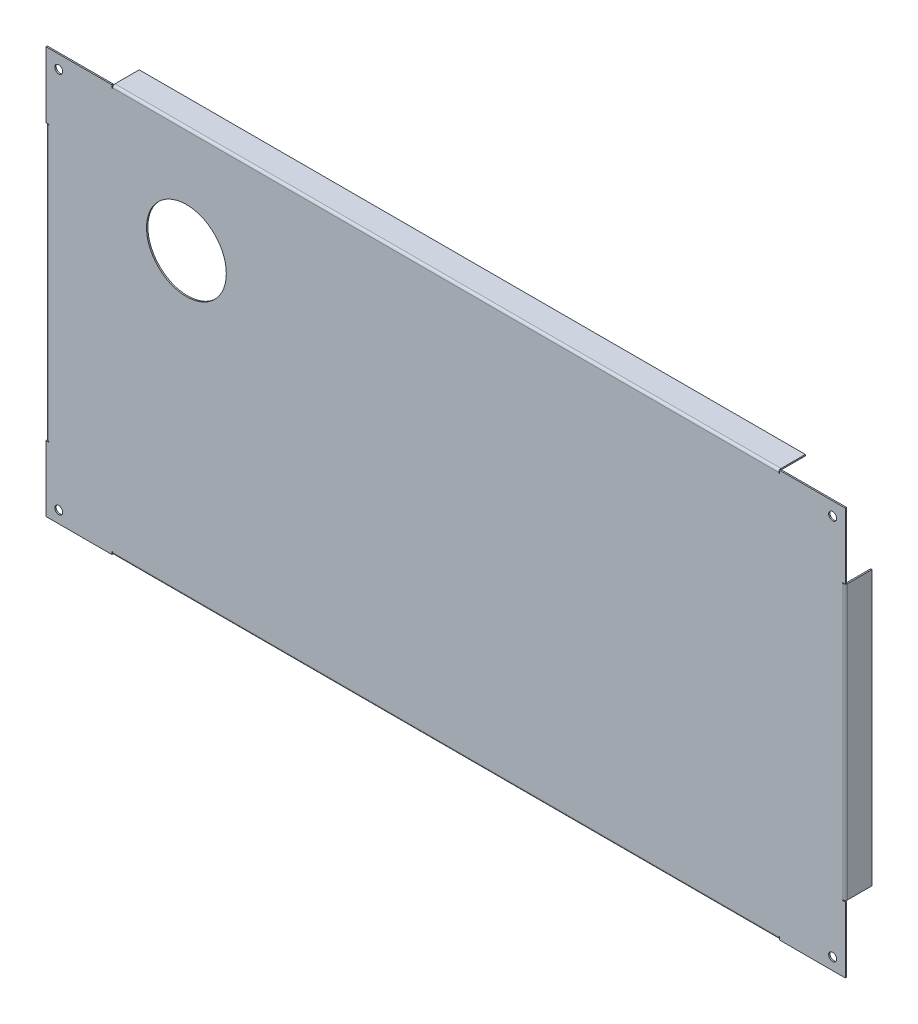
from build123d import *

# Parameters (mm, degrees)
SKETCH_1_W                        = 601
SKETCH_1_H                        = 306
SKETCH_1_R                        = 30
SM_BASE_FLANGE_1_DEPTH            = 1
SM_EDGE_FLANGE_1_STRIP_W          = 5.4732
SM_EDGE_FLANGE_1_STRIP_H          = 1
SM_EDGE_FLANGE_1_STRIP_CUT_DEPTH  = 501
SM_EDGE_FLANGE_1_RELIEF_W         = 5.9732
SM_EDGE_FLANGE_1_RELIEF_H         = 0.5
SM_EDGE_FLANGE_1_RELIEF_CUT_DEPTH = 1
SM_EDGE_FLANGE_1_DEPTH            = 501
SM_EDGE_FLANGE_2_STRIP_W          = 5.4732
SM_EDGE_FLANGE_2_STRIP_H          = 1
SM_EDGE_FLANGE_2_STRIP_CUT_DEPTH  = 206
SM_EDGE_FLANGE_2_RELIEF_W         = 5.9732
SM_EDGE_FLANGE_2_RELIEF_H         = 0.5
SM_EDGE_FLANGE_2_RELIEF_CUT_DEPTH = 1
SM_EDGE_FLANGE_2_DEPTH            = 206
SM_EDGE_FLANGE_3_STRIP_W          = 5.4732
SM_EDGE_FLANGE_3_STRIP_H          = 1
SM_EDGE_FLANGE_3_STRIP_CUT_DEPTH  = 501
SM_EDGE_FLANGE_3_RELIEF_W         = 5.9732
SM_EDGE_FLANGE_3_RELIEF_H         = 0.5
SM_EDGE_FLANGE_3_RELIEF_CUT_DEPTH = 1
SM_EDGE_FLANGE_3_DEPTH            = 501
SM_EDGE_FLANGE_4_STRIP_W          = 5.4732
SM_EDGE_FLANGE_4_STRIP_H          = 1
SM_EDGE_FLANGE_4_STRIP_CUT_DEPTH  = 206
SM_EDGE_FLANGE_4_RELIEF_W         = 5.9732
SM_EDGE_FLANGE_4_RELIEF_H         = 0.5
SM_EDGE_FLANGE_4_RELIEF_CUT_DEPTH = 1
SM_EDGE_FLANGE_4_DEPTH            = 206
SKETCH_15_R                       = 3
CUT_EXTRUDE_1_DEPTH               = 338.800606867


# Sheet-metal steps are written as plain solids
with BuildPart() as part:
    # Sketch 1 → 基体-法兰1 (new body)
    with BuildSketch(Plane.XY):
        Rectangle(SKETCH_1_W, SKETCH_1_H)
        with Locations((-195, 73)):
            Circle(SKETCH_1_R, mode=Mode.SUBTRACT)
    extrude(amount=-SM_BASE_FLANGE_1_DEPTH)

    # 边线-法兰1 strip (across the edge) → 边线-法兰1 strip cut (cut)
    with BuildSketch(Plane(origin=(-250.5, 153, -1), x_dir=(0, -1, 0), z_dir=(1, 0, 0))):
        with Locations((-1, -0.5)):
            Rectangle(SM_EDGE_FLANGE_1_STRIP_W, SM_EDGE_FLANGE_1_STRIP_H)
    extrude(amount=SM_EDGE_FLANGE_1_STRIP_CUT_DEPTH, mode=Mode.SUBTRACT)

    # 边线-法兰1 relief (on the sheet) → 边线-法兰1 relief cut (cut)
    with BuildSketch(Plane(origin=(-250.5, 151.2634, -1), x_dir=(0, -1, 0), z_dir=(0, 0, -1))):
        with Locations((-2.4866, 0.25)):
            Rectangle(SM_EDGE_FLANGE_1_RELIEF_W, SM_EDGE_FLANGE_1_RELIEF_H)
        with Locations((-2.4866, -501.25)):
            Rectangle(SM_EDGE_FLANGE_1_RELIEF_W, SM_EDGE_FLANGE_1_RELIEF_H)
    extrude(amount=-SM_EDGE_FLANGE_1_RELIEF_CUT_DEPTH, mode=Mode.SUBTRACT)

    # 边线-法兰1 section (across the edge) → 边线-法兰1 (add)
    with BuildSketch(Plane(origin=(-250.5, 153, -1), x_dir=(0, -1, 0), z_dir=(1, 0, 0))):
        with BuildLine():
            Line((0, 0.7366), (0, 19))
            Line((0, 19), (1, 19))
            Line((1, 19), (1, 0.7366))
            ThreePointArc((1, 0.7366), (1.215745145, 0.215745145), (1.7366, 0))
            Line((1.7366, 0), (1.7366, -1))
            ThreePointArc((1.7366, -1), (0.508638364, -0.491361636), (0, 0.7366))
        make_face()
    extrude(amount=SM_EDGE_FLANGE_1_DEPTH)

    # 边线-法兰2 strip (across the edge) → 边线-法兰2 strip cut (cut)
    with BuildSketch(Plane(origin=(300.5, 103, -1), x_dir=(-1, 0, 0), z_dir=(0, -1, 0))):
        with Locations((-1, -0.5)):
            Rectangle(SM_EDGE_FLANGE_2_STRIP_W, SM_EDGE_FLANGE_2_STRIP_H)
    extrude(amount=SM_EDGE_FLANGE_2_STRIP_CUT_DEPTH, mode=Mode.SUBTRACT)

    # 边线-法兰2 relief (on the sheet) → 边线-法兰2 relief cut (cut)
    with BuildSketch(Plane(origin=(298.7634, 103, -1), x_dir=(-1, 0, 0), z_dir=(0, 0, -1))):
        with Locations((-2.4866, 0.25)):
            Rectangle(SM_EDGE_FLANGE_2_RELIEF_W, SM_EDGE_FLANGE_2_RELIEF_H)
        with Locations((-2.4866, -206.25)):
            Rectangle(SM_EDGE_FLANGE_2_RELIEF_W, SM_EDGE_FLANGE_2_RELIEF_H)
    extrude(amount=-SM_EDGE_FLANGE_2_RELIEF_CUT_DEPTH, mode=Mode.SUBTRACT)

    # 边线-法兰2 section (across the edge) → 边线-法兰2 (add)
    with BuildSketch(Plane(origin=(300.5, 103, -1), x_dir=(-1, 0, 0), z_dir=(0, -1, 0))):
        with BuildLine():
            Line((0, 0.7366), (0, 19))
            Line((0, 19), (1, 19))
            Line((1, 19), (1, 0.7366))
            ThreePointArc((1, 0.7366), (1.215745145, 0.215745145), (1.7366, 0))
            Line((1.7366, 0), (1.7366, -1))
            ThreePointArc((1.7366, -1), (0.508638364, -0.491361636), (0, 0.7366))
        make_face()
    extrude(amount=SM_EDGE_FLANGE_2_DEPTH)

    # 边线-法兰3 strip (across the edge) → 边线-法兰3 strip cut (cut)
    with BuildSketch(Plane(origin=(250.5, -153, -1), x_dir=(0, 1, 0), z_dir=(-1, 0, 0))):
        with Locations((-1, -0.5)):
            Rectangle(SM_EDGE_FLANGE_3_STRIP_W, SM_EDGE_FLANGE_3_STRIP_H)
    extrude(amount=SM_EDGE_FLANGE_3_STRIP_CUT_DEPTH, mode=Mode.SUBTRACT)

    # 边线-法兰3 relief (on the sheet) → 边线-法兰3 relief cut (cut)
    with BuildSketch(Plane(origin=(250.5, -151.2634, -1), x_dir=(0, 1, 0), z_dir=(0, 0, -1))):
        with Locations((-2.4866, 0.25)):
            Rectangle(SM_EDGE_FLANGE_3_RELIEF_W, SM_EDGE_FLANGE_3_RELIEF_H)
        with Locations((-2.4866, -501.25)):
            Rectangle(SM_EDGE_FLANGE_3_RELIEF_W, SM_EDGE_FLANGE_3_RELIEF_H)
    extrude(amount=-SM_EDGE_FLANGE_3_RELIEF_CUT_DEPTH, mode=Mode.SUBTRACT)

    # 边线-法兰3 section (across the edge) → 边线-法兰3 (add)
    with BuildSketch(Plane(origin=(250.5, -153, -1), x_dir=(0, 1, 0), z_dir=(-1, 0, 0))):
        with BuildLine():
            Line((0, 0.7366), (0, 19))
            Line((0, 19), (1, 19))
            Line((1, 19), (1, 0.7366))
            ThreePointArc((1, 0.7366), (1.215745145, 0.215745145), (1.7366, 0))
            Line((1.7366, 0), (1.7366, -1))
            ThreePointArc((1.7366, -1), (0.508638364, -0.491361636), (0, 0.7366))
        make_face()
    extrude(amount=SM_EDGE_FLANGE_3_DEPTH)

    # 边线-法兰4 strip (across the edge) → 边线-法兰4 strip cut (cut)
    with BuildSketch(Plane(origin=(-300.5, -103, -1), x_dir=(1, 0, 0), z_dir=(0, 1, 0))):
        with Locations((-1, -0.5)):
            Rectangle(SM_EDGE_FLANGE_4_STRIP_W, SM_EDGE_FLANGE_4_STRIP_H)
    extrude(amount=SM_EDGE_FLANGE_4_STRIP_CUT_DEPTH, mode=Mode.SUBTRACT)

    # 边线-法兰4 relief (on the sheet) → 边线-法兰4 relief cut (cut)
    with BuildSketch(Plane(origin=(-298.7634, -103, -1), x_dir=(1, 0, 0), z_dir=(0, 0, -1))):
        with Locations((-2.4866, 0.25)):
            Rectangle(SM_EDGE_FLANGE_4_RELIEF_W, SM_EDGE_FLANGE_4_RELIEF_H)
        with Locations((-2.4866, -206.25)):
            Rectangle(SM_EDGE_FLANGE_4_RELIEF_W, SM_EDGE_FLANGE_4_RELIEF_H)
    extrude(amount=-SM_EDGE_FLANGE_4_RELIEF_CUT_DEPTH, mode=Mode.SUBTRACT)

    # 边线-法兰4 section (across the edge) → 边线-法兰4 (add)
    with BuildSketch(Plane(origin=(-300.5, -103, -1), x_dir=(1, 0, 0), z_dir=(0, 1, 0))):
        with BuildLine():
            Line((0, 0.7366), (0, 19))
            Line((0, 19), (1, 19))
            Line((1, 19), (1, 0.7366))
            ThreePointArc((1, 0.7366), (1.215745145, 0.215745145), (1.7366, 0))
            Line((1.7366, 0), (1.7366, -1))
            ThreePointArc((1.7366, -1), (0.508638364, -0.491361636), (0, 0.7366))
        make_face()
    extrude(amount=SM_EDGE_FLANGE_4_DEPTH)

    # 草图15 → 切除-拉伸1 (cut, through all)
    with BuildSketch(Plane.XY):
        with Locations((-291, -144)):
            Circle(SKETCH_15_R)
        with Locations((-291, 143)):
            Circle(SKETCH_15_R)
        with Locations((291, 143)):
            Circle(SKETCH_15_R)
        with Locations((291, -144)):
            Circle(SKETCH_15_R)
    extrude(amount=-CUT_EXTRUDE_1_DEPTH, mode=Mode.SUBTRACT)


solid = part.part
